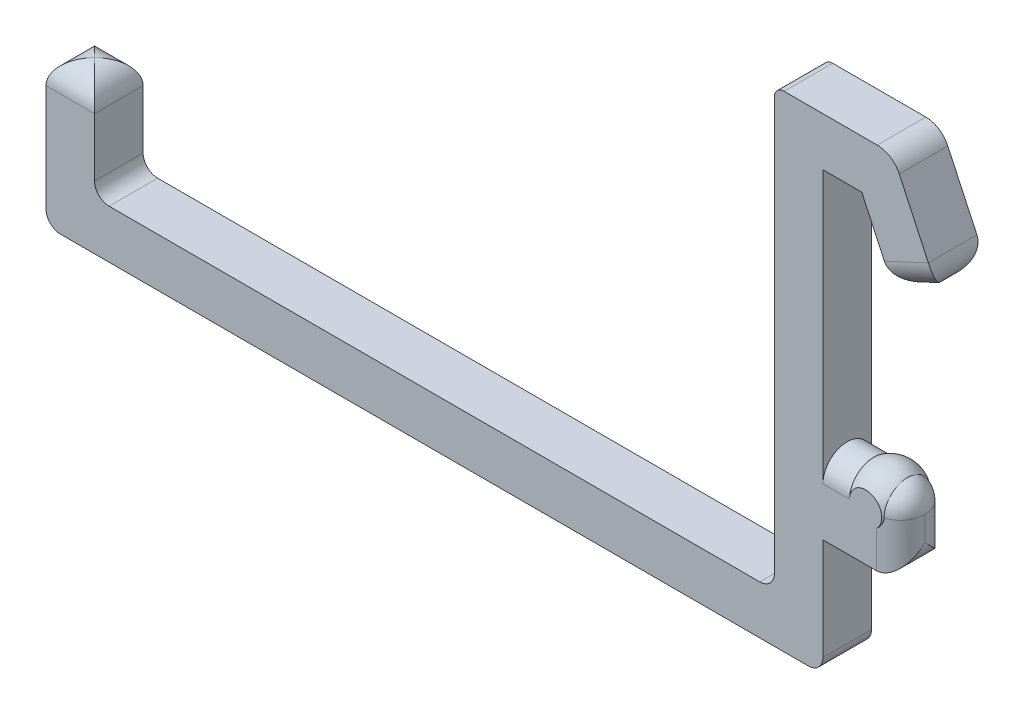
from build123d import *

# Parameters (mm, degrees)
EXTRUDE_1_DEPTH     = 5
FILLET_1_R          = 2.5
FILLET_2_R          = 1
EXTRUDE_2_DEPTH     = 8
FILLET_3_R          = 2.5
SKETCH_5_W          = 1.467751534
SKETCH_5_H          = 4.178210798
SKETCH_5_W_2        = 1.389566385
CUT_EXTRUDE_1_DEPTH = 20
FILLET_4_R          = 1.5
FILLET_5_R          = 1.5


with BuildPart() as part:
    # 草图1 → 凸台-拉伸1 (new body)
    with BuildSketch(Plane.XY):
        Polygon((0, 0), (0, 28), (4, 28), (7.380946094, 20.749537704), (11.912485029, 22.862629012), (7.185351304, 33), (-5, 33), (-5, -12), (-75, -12), (-75, -2), (-80, -2), (-80, -17), (0, -17), (0, -5), (8, -5), (8, 0), align=None)
    extrude(amount=EXTRUDE_1_DEPTH)

    # 圆角1
    fillet_1_edges = [part.edges().sort_by_distance(p)[0] for p in [
        (-77.5, -2, 0),
        (9.646715562, 21.806083358, 0),
        (9.646715562, 21.806083358, 5),
        (-80, -2, 2.5),
        (-75, -2, 2.5),
        (7.185351304, 33, 2.5),
        (11.912485029, 22.862629012, 2.5),
        (7.380946094, 20.749537704, 2.5),
        (-77.5, -2, 5),
    ]]
    fillet(fillet_1_edges, radius=FILLET_1_R - 0.0001)  # a hair under: the kernel refuses the full size

    # 圆角2
    fillet_2_edges = [part.edges().sort_by_distance(p)[0] for p in [
        (-5, 33, 2.5),
    ]]
    fillet(fillet_2_edges, radius=FILLET_2_R)

    # 草图3 → 凸台-拉伸2 (add)
    with BuildSketch(Plane(origin=(0, 0, 0), x_dir=(0, 0, -1), z_dir=(1, 0, 0))):
        with BuildLine():
            Line((-5, 0), (0, 0))
            ThreePointArc((0, 0), (-2.5, 2.5), (-5, 0))
        make_face()
    extrude(amount=EXTRUDE_2_DEPTH)

    # 圆角3
    fillet_3_edges = [part.edges().sort_by_distance(p)[0] for p in [
        (8, -2.5, 0),
        (8, -5, 2.5),
        (8, -2.5, 5),
        (8, 2.5, 2.5),
    ]]
    fillet(fillet_3_edges, radius=FILLET_3_R - 0.0001)  # a hair under: the kernel refuses the full size

    # 草图4 → 旋转3 (revolve)
    with BuildSketch(Plane(origin=(4.4, 0, 0), x_dir=(0, 0, -1), z_dir=(1, 0, 0))):
        with BuildLine():
            Line((-5.5, 0), (0.5, 0))
            ThreePointArc((0.5, 0), (-2.5, 3), (-5.5, 0))
        make_face()
    revolve(axis=Axis((4.4, 0, 2.5), (0, 0, -1)))

    # 草图5 → 切除-拉伸1 (cut)
    with BuildSketch(Plane.ZY.offset(5)):
        with Locations((-0.733875767, -0.010051234)):
            Rectangle(SKETCH_5_W, SKETCH_5_H)
        with Locations((5.694783193, -0.010051234)):
            Rectangle(SKETCH_5_W_2, SKETCH_5_H)
    extrude(amount=-CUT_EXTRUDE_1_DEPTH, mode=Mode.SUBTRACT)

    # 圆角4
    fillet_4_edges = [part.edges().sort_by_distance(p)[0] for p in [
        (-75, -12, 2.5),
        (-5, -12, 2.5),
    ]]
    fillet(fillet_4_edges, radius=FILLET_4_R)

    # 圆角5
    fillet_5_edges = [part.edges().sort_by_distance(p)[0] for p in [
        (0, -17, 2.5),
        (-80, -17, 2.5),
    ]]
    fillet(fillet_5_edges, radius=FILLET_5_R)


solid = part.part
